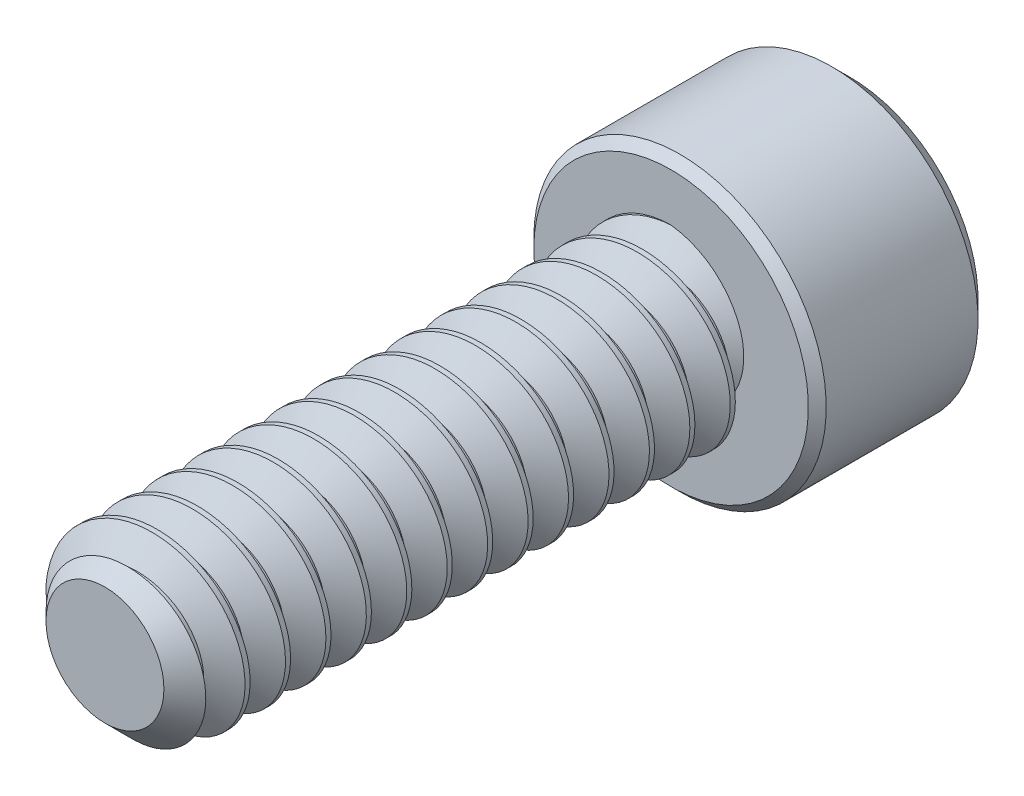
from build123d import *

# Parameters (mm, degrees)
SKETCH1_R          = 1.7526
EXTRUDE1_DEPTH     = 11.1125
CHAMFER3_SIZE      = 0.5953125
CUT_SWEEP1_PITCH   = 0.79375
SKETCH6_R          = 2.8702
EXTRUDE2_DEPTH     = 3.5052
CUT_EXTRUDE1_DEPTH = 2.08359375
SKETCH8_R          = 1.603951217
CUT_EXTRUDE2_DEPTH = 0.35052
CUT_EXTRUDE2_DRAFT = -45
CHAMFER1_SIZE      = 0.35052
CHAMFER2_SIZE      = 0.17526


with BuildPart() as part:
    # Sketch1 → Extrude1 (new body)
    with BuildSketch(Plane.XY):
        Circle(SKETCH1_R)
    extrude(amount=-EXTRUDE1_DEPTH)

    # Chamfer3
    chamfer3_edges = [part.edges().sort_by_distance(p)[0] for p in [
        (-1.7526, 0, 0),
    ]]
    chamfer(chamfer3_edges, length=CHAMFER3_SIZE)

    # Cut-Sweep1: the profile of Sketch3 profile screwed along a right-hand helix of 15 turns, 6 arcs to a turn; built about Z, then put on its axis
    cut_sweep1_z = Axis((0, 0, 0), (0, 0, 1))
    cut_sweep1_corners = [(1.7529, 0, -0.694704455), (1.237044252, 0, -0.396875), (1.237044252, 0, -0.29765625), (1.7529, 0, 0.000173205)]
    with BuildLine(mode=Mode.PRIVATE) as cut_sweep1_profile:
        Line(cut_sweep1_corners[0], cut_sweep1_corners[1])
        Line(cut_sweep1_corners[1], cut_sweep1_corners[2])
        Line(cut_sweep1_corners[2], cut_sweep1_corners[3])
        Line(cut_sweep1_corners[3], cut_sweep1_corners[0])
    cut_sweep1_cap = Face(cut_sweep1_profile.wire())
    cut_sweep1_turn_angles = [0, 30, 60, 90, 120, 150, 180, 210, 240, 270, 300, 330, 360]
    cut_sweep1_turn_weights = [1, 0.8660254037844387, 1, 0.8660254037844387, 1, 0.8660254037844387, 1, 0.8660254037844387, 1, 0.8660254037844387, 1, 0.8660254037844387, 1]
    cut_sweep1_turn_rails = [Edge.make_bspline([Vector(p[0], p[1], 0).rotate(cut_sweep1_z, cut_sweep1_turn_angles[k]) / cut_sweep1_turn_weights[k] + Vector(0, 0, p[2] + CUT_SWEEP1_PITCH * cut_sweep1_turn_angles[k] / 360) for k in range(13)], [0, 0, 0, 1, 1, 2, 2, 3, 3, 4, 4, 5, 5, 6, 6, 6], 2, cut_sweep1_turn_weights) for p in cut_sweep1_corners]
    cut_sweep1_turn_sides = [Face.make_surface_from_curves(cut_sweep1_turn_rails[p[0]], cut_sweep1_turn_rails[p[1]]) for p in [(0, 1), (1, 2), (2, 3), (3, 0)]]
    cut_sweep1 = Plane(origin=(0, 0, 0), x_dir=(0, 1, 0), z_dir=(0, 0, -1)) * Solid(Shell([*[p.moved(Location((0, 0, CUT_SWEEP1_PITCH * i))) for i in range(15) for p in cut_sweep1_turn_sides], cut_sweep1_cap, cut_sweep1_cap.rotate(cut_sweep1_z, 5400).moved(Location((0, 0, CUT_SWEEP1_PITCH * 5400 / 360)))]))
    add(cut_sweep1, mode=Mode.SUBTRACT)

    # Sketch6 → Extrude2 (add)
    with BuildSketch(Plane(origin=(0, 0, -11.1125), x_dir=(-1, 0, 0), z_dir=(0, 0, -1))):
        Circle(SKETCH6_R)
    extrude(amount=EXTRUDE2_DEPTH)

    # Sketch7 → Cut-Extrude1 (cut)
    with BuildSketch(Plane(origin=(0, 0, -14.6177), x_dir=(-1, 0, 0), z_dir=(0, 0, -1))):
        Polygon((0, 1.603951217), (-1.3890625, 0.801975608), (-1.3890625, -0.801975608), (0, -1.603951217), (1.3890625, -0.801975608), (1.3890625, 0.801975608), align=None)
    extrude(amount=-CUT_EXTRUDE1_DEPTH, mode=Mode.SUBTRACT)


with BuildPart() as cut_extrude2_tool:
    # Sketch8 → Cut-Extrude2 (with draft: the straight prism first)
    with BuildSketch(Plane(origin=(0, 0, -14.6177), x_dir=(-1, 0, 0), z_dir=(0, 0, -1))):
        Circle(SKETCH8_R)
    extrude(amount=-CUT_EXTRUDE2_DEPTH)
    # Cut-Extrude2: the draft: its side faces are tilted about the plane it starts from
    cut_extrude2_sides = [cut_extrude2_tool.faces().sort_by_distance(p)[0] for p in [
        (1.603951217, 0, -14.44244),
    ]]
    draft(cut_extrude2_sides, Plane(origin=(0, 0, -14.6177), x_dir=(-1, 0, 0), z_dir=(0, 0, -1)), CUT_EXTRUDE2_DRAFT)


with BuildPart() as part_1:
    add(part.part)

    # Cut-Extrude2: cut by cut_extrude2_tool
    add(cut_extrude2_tool.part, mode=Mode.SUBTRACT)

    # Chamfer1
    chamfer1_edges = [part_1.edges().sort_by_distance(p)[0] for p in [
        (2.8702, 0, -14.6177),
    ]]
    chamfer(chamfer1_edges, length=CHAMFER1_SIZE)

    # Chamfer2
    chamfer2_edges = [part_1.edges().sort_by_distance(p)[0] for p in [
        (2.8702, 0, -11.1125),
    ]]
    chamfer(chamfer2_edges, length=CHAMFER2_SIZE)


solid = part_1.part
